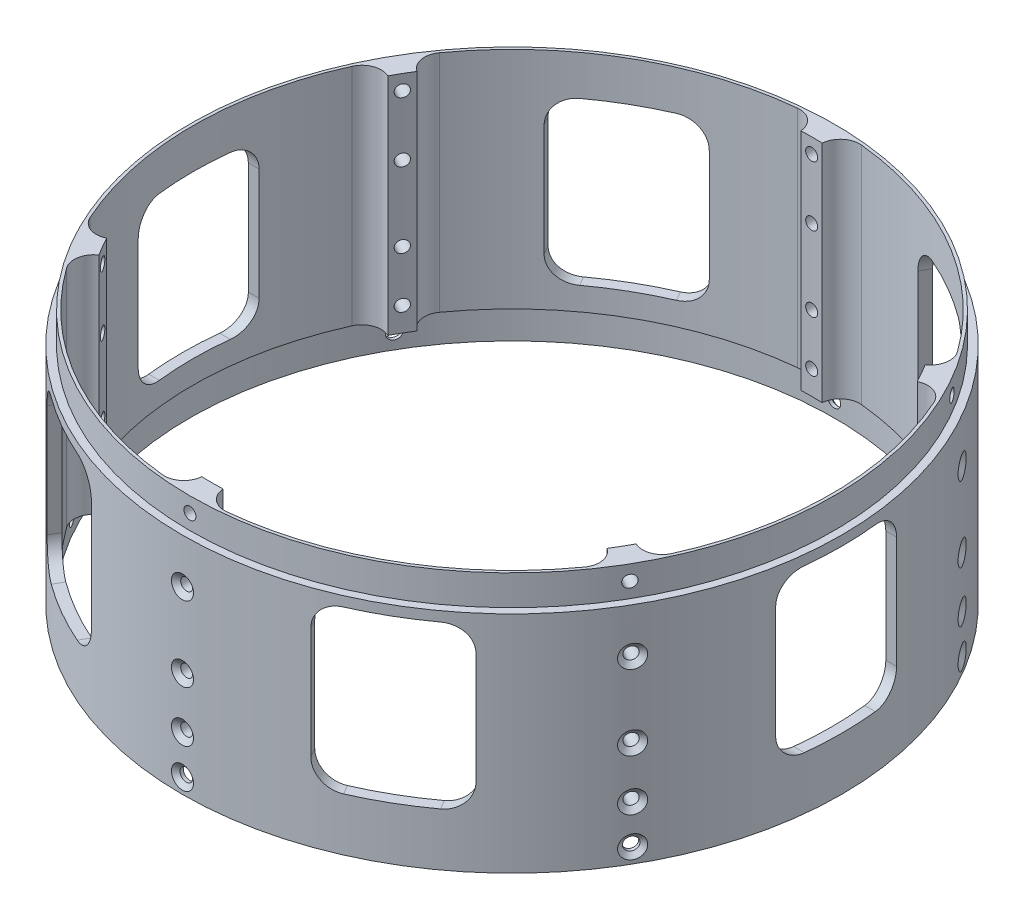
from build123d import *

# Parameters (mm, degrees)
CUT_EXTRUDE1_DEPTH                        = 136.0804860074171
CIRPATTERN1_COUNT                         = 6
TAPPED_HOLE_FOR_4_40_HELICOIL1_AT_2_COUNT = 2
TAPPED_HOLE_FOR_4_40_HELICOIL1_AT_2_PITCH = 47.244
TAPPED_HOLE_FOR_4_40_HELICOIL1_AT_3_COUNT = 2
TAPPED_HOLE_FOR_4_40_HELICOIL1_AT_3_PITCH = 34.28999999999999
TAPPED_HOLE_FOR_4_40_HELICOIL1_AT_4_COUNT = 2
TAPPED_HOLE_FOR_4_40_HELICOIL1_AT_4_PITCH = 15.239999999999998
CIRPATTERN2_COUNT                         = 6
CUT_EXTRUDE2_DEPTH                        = 136.0804861794701
CIRPATTERN5_COUNT                         = 3


with BuildPart() as part:
    # Sketch1 → Revolve1 (revolve)
    with BuildSketch(Plane.XY):
        Polygon((76.2, -57.15), (76.20000000000003, 0), (81.88960000000003, 0), (81.88960000000003, -7.6708), (83.82000000000004, -7.670799999999989), (83.82000000000004, -64.77), (81.94040000000005, -64.77), (81.94040000000004, -57.15), align=None)
    revolve(axis=Axis((0, 42.39510168777739, 0), (0, -1, 0)))

    # Sketch2 → Cut-Extrude1 (cut, through all)
    with BuildSketch(Plane(origin=(0, 0, 0), x_dir=(1, 0, 0), z_dir=(0, 1, 0))):
        with BuildLine():
            ThreePointArc((-8.128016987239903, 80.71940796125271), (-40.563800000000136, 70.25856254806241), (-65.8410493792649, 47.39877317396734))
            ThreePointArc((-65.8410493792649, 47.39877317396734), (-64.72088607812911, 40.52071256804154), (-57.842825472203295, 41.64087586917733))
            ThreePointArc((-57.842825472203295, 41.64087586917733), (-35.63620000000011, 61.72370898868599), (-7.140643602440563, 70.9137942201863))
            ThreePointArc((-7.140643602440563, 70.9137942201863), (-2.7315234243070465, 76.3102877831192), (-8.128016987239903, 80.71940796125271))
        make_face()
    cut_extrude1 = extrude(amount=-CUT_EXTRUDE1_DEPTH, mode=Mode.SUBTRACT)

    # CirPattern1: Cut-Extrude1 ×6 about axis
    cirpattern1_axis = Axis((0, 42.39510168777739, 0), (0, 1, 0))
    for i in range(1, CIRPATTERN1_COUNT):
        add(cut_extrude1.rotate(cirpattern1_axis, i * 360 / CIRPATTERN1_COUNT), mode=Mode.SUBTRACT)

    # Sketch4 → Tapped Hole for #4-40 Helicoil1 (revolve, cut)
    with BuildSketch(Plane(origin=(0, -3.8099999999999996, 83.82), x_dir=(0, -1, 0), z_dir=(1, 0, 0))):
        Polygon((0, 0), (-6.45e-15, 26.315711583397988), (1.5239999999999854, 25.39999999999999), (1.5239999999999967, 1.1189393581749023), (2.8575, 0), align=None)
    tapped_hole_for_4_40_helicoil1 = revolve(axis=Axis((0, -3.8099999999999996, 90.16999999999999), (0, 0, -1)), mode=Mode.SUBTRACT)

    # Tapped Hole for #4-40 Helicoil1 at 2: Tapped Hole for #4-40 Helicoil1 ×2
    with Locations(*[(0, -i * TAPPED_HOLE_FOR_4_40_HELICOIL1_AT_2_PITCH, 0) for i in range(1, TAPPED_HOLE_FOR_4_40_HELICOIL1_AT_2_COUNT)]):
        add(tapped_hole_for_4_40_helicoil1, mode=Mode.SUBTRACT)

    # Tapped Hole for #4-40 Helicoil1 at 3: Tapped Hole for #4-40 Helicoil1 ×2
    with Locations(*[(0, -i * TAPPED_HOLE_FOR_4_40_HELICOIL1_AT_3_PITCH, 0) for i in range(1, TAPPED_HOLE_FOR_4_40_HELICOIL1_AT_3_COUNT)]):
        add(tapped_hole_for_4_40_helicoil1, mode=Mode.SUBTRACT)

    # Tapped Hole for #4-40 Helicoil1 at 4: Tapped Hole for #4-40 Helicoil1 ×2
    with Locations(*[(0, -i * TAPPED_HOLE_FOR_4_40_HELICOIL1_AT_4_PITCH, 0) for i in range(1, TAPPED_HOLE_FOR_4_40_HELICOIL1_AT_4_COUNT)]):
        add(tapped_hole_for_4_40_helicoil1, mode=Mode.SUBTRACT)

    # Sketch6 → CSK for #4 Flat Head Machine Screw (100)1 (revolve, cut)
    with BuildSketch(Plane(origin=(1.24e-15, -60.96, 83.82), x_dir=(0, -1, 0), z_dir=(1, 0, 0))):
        Polygon((0, 0), (-6.45e-15, 26.380574487222027), (1.6319499999999938, 25.4), (1.631949999999997, 1.0283585529893176), (2.8575, 0), align=None)
    csk_for_4_flat_head_machine_screw_100 = revolve(axis=Axis((1.24e-15, -60.96, 90.16999999999999), (0, 0, -1)), mode=Mode.SUBTRACT)

    # CirPattern2: Tapped Hole for #4-40 Helicoil1, CSK for #4 Flat Head Machine Screw (100)1 ×6 about axis
    cirpattern2_axis = Axis((0, 42.39510168777739, 0), (0, 1, 0))
    add([tapped_hole_for_4_40_helicoil1.rotate(cirpattern2_axis, i * 360 / CIRPATTERN2_COUNT) for i in range(1, CIRPATTERN2_COUNT)], mode=Mode.SUBTRACT)
    add([csk_for_4_flat_head_machine_screw_100.rotate(cirpattern2_axis, i * 360 / CIRPATTERN2_COUNT) for i in range(1, CIRPATTERN2_COUNT)], mode=Mode.SUBTRACT)

    # CirPattern2 copy 1 sketch → CirPattern2 copy 1 (revolve, cut)
    with BuildSketch(Plane(origin=(72.59024934521163, -51.054, 41.910000000000004), x_dir=(0, -1, 0), z_dir=(0.5000000000000001, 0, -0.8660254037844386))):
        Polygon((0, 0), (-6.45e-15, 26.315711583397988), (1.5239999999999854, 25.39999999999999), (1.5239999999999967, 1.1189393581749023), (2.8575, 0), align=None)
    revolve(axis=Axis((78.08951065924282, -51.054, 45.085), (-0.8660254037844386, 0, -0.5000000000000001)), mode=Mode.SUBTRACT)

    # CirPattern2 copy 2 sketch → CirPattern2 copy 2 (revolve, cut)
    with BuildSketch(Plane(origin=(72.59024934521165, -51.054, -41.909999999999975), x_dir=(0, -1, 0), z_dir=(-0.4999999999999998, 0, -0.8660254037844387))):
        Polygon((0, 0), (-6.45e-15, 26.315711583397988), (1.5239999999999854, 25.39999999999999), (1.5239999999999967, 1.1189393581749023), (2.8575, 0), align=None)
    revolve(axis=Axis((78.08951065924283, -51.054, -45.08499999999997), (-0.8660254037844387, 0, 0.4999999999999998)), mode=Mode.SUBTRACT)

    # CirPattern2 copy 3 sketch → CirPattern2 copy 3 (revolve, cut)
    with BuildSketch(Plane(origin=(1.026e-14, -51.054, -83.82), x_dir=(0, -1, 0), z_dir=(-1, 0, -1.2e-16))):
        Polygon((0, 0), (-6.45e-15, 26.315711583397988), (1.5239999999999854, 25.39999999999999), (1.5239999999999967, 1.1189393581749023), (2.8575, 0), align=None)
    revolve(axis=Axis((1.104e-14, -51.054, -90.16999999999999), (-1.2e-16, 0, 1)), mode=Mode.SUBTRACT)

    # CirPattern2 copy 4 sketch → CirPattern2 copy 4 (revolve, cut)
    with BuildSketch(Plane(origin=(-72.59024934521162, -51.054, -41.91000000000003), x_dir=(0, -1, 0), z_dir=(-0.5000000000000004, 0, 0.8660254037844384))):
        Polygon((0, 0), (-6.45e-15, 26.315711583397988), (1.5239999999999854, 25.39999999999999), (1.5239999999999967, 1.1189393581749023), (2.8575, 0), align=None)
    revolve(axis=Axis((-78.08951065924279, -51.054, -45.085000000000036), (0.8660254037844384, 0, 0.5000000000000004)), mode=Mode.SUBTRACT)

    # CirPattern2 copy 5 sketch → CirPattern2 copy 5 (revolve, cut)
    with BuildSketch(Plane(origin=(-72.59024934521163, -51.054, 41.910000000000004), x_dir=(0, -1, 0), z_dir=(0.5000000000000001, 0, 0.8660254037844386))):
        Polygon((0, 0), (-6.45e-15, 26.315711583397988), (1.5239999999999854, 25.39999999999999), (1.5239999999999967, 1.1189393581749023), (2.8575, 0), align=None)
    revolve(axis=Axis((-78.08951065924282, -51.054, 45.085), (0.8660254037844386, 0, -0.5000000000000001)), mode=Mode.SUBTRACT)

    # CirPattern2 copy 6 sketch → CirPattern2 copy 6 (revolve, cut)
    with BuildSketch(Plane(origin=(72.59024934521163, -38.099999999999994, 41.910000000000004), x_dir=(0, -1, 0), z_dir=(0.5000000000000001, 0, -0.8660254037844386))):
        Polygon((0, 0), (-6.45e-15, 26.315711583397988), (1.5239999999999854, 25.39999999999999), (1.5239999999999967, 1.1189393581749023), (2.8575, 0), align=None)
    revolve(axis=Axis((78.08951065924282, -38.099999999999994, 45.085), (-0.8660254037844386, 0, -0.5000000000000001)), mode=Mode.SUBTRACT)

    # CirPattern2 copy 7 sketch → CirPattern2 copy 7 (revolve, cut)
    with BuildSketch(Plane(origin=(72.59024934521165, -38.099999999999994, -41.909999999999975), x_dir=(0, -1, 0), z_dir=(-0.4999999999999998, 0, -0.8660254037844387))):
        Polygon((0, 0), (-6.45e-15, 26.315711583397988), (1.5239999999999854, 25.39999999999999), (1.5239999999999967, 1.1189393581749023), (2.8575, 0), align=None)
    revolve(axis=Axis((78.08951065924283, -38.099999999999994, -45.08499999999997), (-0.8660254037844387, 0, 0.4999999999999998)), mode=Mode.SUBTRACT)

    # CirPattern2 copy 8 sketch → CirPattern2 copy 8 (revolve, cut)
    with BuildSketch(Plane(origin=(1.026e-14, -38.099999999999994, -83.82), x_dir=(0, -1, 0), z_dir=(-1, 0, -1.2e-16))):
        Polygon((0, 0), (-6.45e-15, 26.315711583397988), (1.5239999999999854, 25.39999999999999), (1.5239999999999967, 1.1189393581749023), (2.8575, 0), align=None)
    revolve(axis=Axis((1.104e-14, -38.099999999999994, -90.16999999999999), (-1.2e-16, 0, 1)), mode=Mode.SUBTRACT)

    # CirPattern2 copy 9 sketch → CirPattern2 copy 9 (revolve, cut)
    with BuildSketch(Plane(origin=(-72.59024934521162, -38.099999999999994, -41.91000000000003), x_dir=(0, -1, 0), z_dir=(-0.5000000000000004, 0, 0.8660254037844384))):
        Polygon((0, 0), (-6.45e-15, 26.315711583397988), (1.5239999999999854, 25.39999999999999), (1.5239999999999967, 1.1189393581749023), (2.8575, 0), align=None)
    revolve(axis=Axis((-78.08951065924279, -38.099999999999994, -45.085000000000036), (0.8660254037844384, 0, 0.5000000000000004)), mode=Mode.SUBTRACT)

    # CirPattern2 copy 10 sketch → CirPattern2 copy 10 (revolve, cut)
    with BuildSketch(Plane(origin=(-72.59024934521163, -38.099999999999994, 41.910000000000004), x_dir=(0, -1, 0), z_dir=(0.5000000000000001, 0, 0.8660254037844386))):
        Polygon((0, 0), (-6.45e-15, 26.315711583397988), (1.5239999999999854, 25.39999999999999), (1.5239999999999967, 1.1189393581749023), (2.8575, 0), align=None)
    revolve(axis=Axis((-78.08951065924282, -38.099999999999994, 45.085), (0.8660254037844386, 0, -0.5000000000000001)), mode=Mode.SUBTRACT)

    # CirPattern2 copy 11 sketch → CirPattern2 copy 11 (revolve, cut)
    with BuildSketch(Plane(origin=(72.59024934521163, -19.049999999999997, 41.910000000000004), x_dir=(0, -1, 0), z_dir=(0.5000000000000001, 0, -0.8660254037844386))):
        Polygon((0, 0), (-6.45e-15, 26.315711583397988), (1.5239999999999854, 25.39999999999999), (1.5239999999999967, 1.1189393581749023), (2.8575, 0), align=None)
    revolve(axis=Axis((78.08951065924282, -19.049999999999997, 45.085), (-0.8660254037844386, 0, -0.5000000000000001)), mode=Mode.SUBTRACT)

    # CirPattern2 copy 12 sketch → CirPattern2 copy 12 (revolve, cut)
    with BuildSketch(Plane(origin=(72.59024934521165, -19.049999999999997, -41.909999999999975), x_dir=(0, -1, 0), z_dir=(-0.4999999999999998, 0, -0.8660254037844387))):
        Polygon((0, 0), (-6.45e-15, 26.315711583397988), (1.5239999999999854, 25.39999999999999), (1.5239999999999967, 1.1189393581749023), (2.8575, 0), align=None)
    revolve(axis=Axis((78.08951065924283, -19.049999999999997, -45.08499999999997), (-0.8660254037844387, 0, 0.4999999999999998)), mode=Mode.SUBTRACT)

    # CirPattern2 copy 13 sketch → CirPattern2 copy 13 (revolve, cut)
    with BuildSketch(Plane(origin=(1.026e-14, -19.049999999999997, -83.82), x_dir=(0, -1, 0), z_dir=(-1, 0, -1.2e-16))):
        Polygon((0, 0), (-6.45e-15, 26.315711583397988), (1.5239999999999854, 25.39999999999999), (1.5239999999999967, 1.1189393581749023), (2.8575, 0), align=None)
    revolve(axis=Axis((1.104e-14, -19.049999999999997, -90.16999999999999), (-1.2e-16, 0, 1)), mode=Mode.SUBTRACT)

    # CirPattern2 copy 14 sketch → CirPattern2 copy 14 (revolve, cut)
    with BuildSketch(Plane(origin=(-72.59024934521162, -19.049999999999997, -41.91000000000003), x_dir=(0, -1, 0), z_dir=(-0.5000000000000004, 0, 0.8660254037844384))):
        Polygon((0, 0), (-6.45e-15, 26.315711583397988), (1.5239999999999854, 25.39999999999999), (1.5239999999999967, 1.1189393581749023), (2.8575, 0), align=None)
    revolve(axis=Axis((-78.08951065924279, -19.049999999999997, -45.085000000000036), (0.8660254037844384, 0, 0.5000000000000004)), mode=Mode.SUBTRACT)

    # CirPattern2 copy 15 sketch → CirPattern2 copy 15 (revolve, cut)
    with BuildSketch(Plane(origin=(-72.59024934521163, -19.049999999999997, 41.910000000000004), x_dir=(0, -1, 0), z_dir=(0.5000000000000001, 0, 0.8660254037844386))):
        Polygon((0, 0), (-6.45e-15, 26.315711583397988), (1.5239999999999854, 25.39999999999999), (1.5239999999999967, 1.1189393581749023), (2.8575, 0), align=None)
    revolve(axis=Axis((-78.08951065924282, -19.049999999999997, 45.085), (0.8660254037844386, 0, -0.5000000000000001)), mode=Mode.SUBTRACT)

    # Sketch7 → Cut-Extrude2 (cut, symmetric)
    with BuildSketch(Plane(origin=(0, 0, 0), x_dir=(0, 0, -1), z_dir=(1, 0, 0))):
        with BuildLine():
            Line((-9.017000000000003, -10.160000000000002), (9.016999999999996, -10.160000000000002))
            ThreePointArc((9.016999999999996, -10.160000000000002), (13.507128060534573, -12.019871939465428), (15.366999999999996, -16.510000000000005))
            Line((15.366999999999996, -16.510000000000005), (15.366999999999999, -44.958000000000006))
            ThreePointArc((15.366999999999999, -44.958000000000006), (13.507128060534576, -49.448128060534586), (9.017, -51.30800000000001))
            Line((9.017, -51.30800000000001), (-9.017, -51.30800000000001))
            ThreePointArc((-9.017, -51.30800000000001), (-13.507128060534576, -49.44812806053458), (-15.366999999999999, -44.958000000000006))
            Line((-15.366999999999999, -44.958000000000006), (-15.367000000000003, -16.510000000000005))
            ThreePointArc((-15.367000000000003, -16.510000000000005), (-13.507128060534582, -12.019871939465425), (-9.017000000000003, -10.160000000000002))
        make_face()
    cut_extrude2 = extrude(amount=CUT_EXTRUDE2_DEPTH, both=True, mode=Mode.SUBTRACT)

    # CirPattern5: Cut-Extrude2 ×3 about axis
    cirpattern5_axis = Axis((0, -7.670799999999992, 0), (0, 1, 0))
    for i in range(1, CIRPATTERN5_COUNT):
        add(cut_extrude2.rotate(cirpattern5_axis, i * 360 / CIRPATTERN5_COUNT), mode=Mode.SUBTRACT)


solid = part.part
